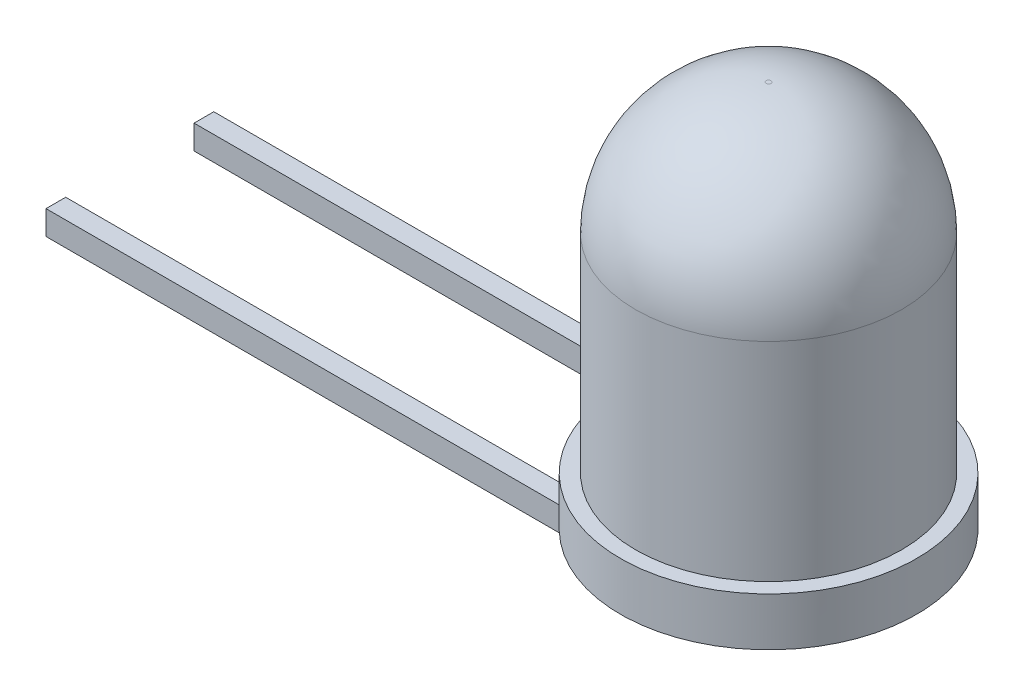
from build123d import *

# Parameters (mm, degrees)
SKETCH1_R           = 2.75
BOSS_EXTRUDE1_DEPTH = 7
FILLET1_R           = 2.7
SKETCH2_R           = 3.061280108
BOSS_EXTRUDE2_DEPTH = 1
BOSS_EXTRUDE3_DEPTH = 0.5
FILLET2_R           = 0.7


with BuildPart() as part:
    # Sketch1 → Boss-Extrude1 (new body)
    with BuildSketch(Plane(origin=(0, 0, 0), x_dir=(1, 0, 0), z_dir=(0, 1, 0))):
        with Locations(Location((0, 0, 0), (0, 0, 270))):
            Circle(SKETCH1_R)
    extrude(amount=BOSS_EXTRUDE1_DEPTH)

    # Fillet1
    fillet1_edges = [part.edges().sort_by_distance(p)[0] for p in [
        (0, 7, -2.75),
    ]]
    fillet(fillet1_edges, radius=FILLET1_R)

    # Sketch2 → Boss-Extrude2 (add)
    with BuildSketch(Plane.XZ):
        with Locations(Location((0, 0, 0), (0, 0, 270))):
            Circle(SKETCH2_R)
    extrude(amount=BOSS_EXTRUDE2_DEPTH)

    # Sketch3 → Boss-Extrude3 (add)
    with BuildSketch(Plane.XZ.offset(1)):
        with BuildLine():
            ThreePointArc((-2.522635735, 1.734285112), (-2.648517192, 1.535184868), (-2.758717126, 1.326994996))
            Line((-2.758717126, 1.326994996), (0, 1.326994996))
            Line((0, 1.326994996), (0, 1.734285112))
            Line((0, 1.734285112), (-2.522635735, 1.734285112))
        make_face()
        with BuildLine():
            Line((-13.203045703, 1.326994996), (-2.758717126, 1.326994996))
            ThreePointArc((-2.758717126, 1.326994996), (-2.648517192, 1.535184868), (-2.522635735, 1.734285112))
            Line((-2.522635735, 1.734285112), (-13.203045703, 1.734285112))
            Line((-13.203045703, 1.734285112), (-13.203045703, 1.326994996))
        make_face()
        with BuildLine():
            Line((-2.522635735, -1.734285112), (0, -1.734285112))
            Line((0, -1.734285112), (0, -1.326994996))
            Line((0, -1.326994996), (-2.758717126, -1.326994996))
            ThreePointArc((-2.758717126, -1.326994996), (-2.648517192, -1.535184868), (-2.522635735, -1.734285112))
        make_face()
        with BuildLine():
            Line((-13.203045703, -1.734285112), (-2.522635735, -1.734285112))
            ThreePointArc((-2.522635735, -1.734285112), (-2.648517192, -1.535184868), (-2.758717126, -1.326994996))
            Line((-2.758717126, -1.326994996), (-13.203045703, -1.326994996))
            Line((-13.203045703, -1.326994996), (-13.203045703, -1.734285112))
        make_face()
    extrude(amount=BOSS_EXTRUDE3_DEPTH)

    # Fillet2
    # the kernel refuses this fillet: 0.7 mm, written as the material it takes off along each edge
    with BuildSketch(Plane(origin=(0, -1.5, -3.411336095), x_dir=(0, 1, 0), z_dir=(0, 0, 1)), Plane(origin=(0, -1.5, -0.350055987), x_dir=(0, 1, 0), z_dir=(0, 0, 1))) as fillet2_piece_1:
        with BuildLine():
            CenterArc((0.7, 0.670820393), FILLET2_R, 180, 73.398450401)
            Line((0, 0.670820393), (-0.014, 0.670820393))
            Line((-0.014, 0.670820393), (-0.014, 0))
            Line((-0.014, 0), (0, -0.014))
            ThreePointArc((0, -0.014), (0.25, -0.014), (0.496, -0.013416408))
            Line((0.496, -0.013416408), (0.5, 0))
        make_face()
    extrude(amount=3.761392082, mode=Mode.SUBTRACT)


solid = part.part
